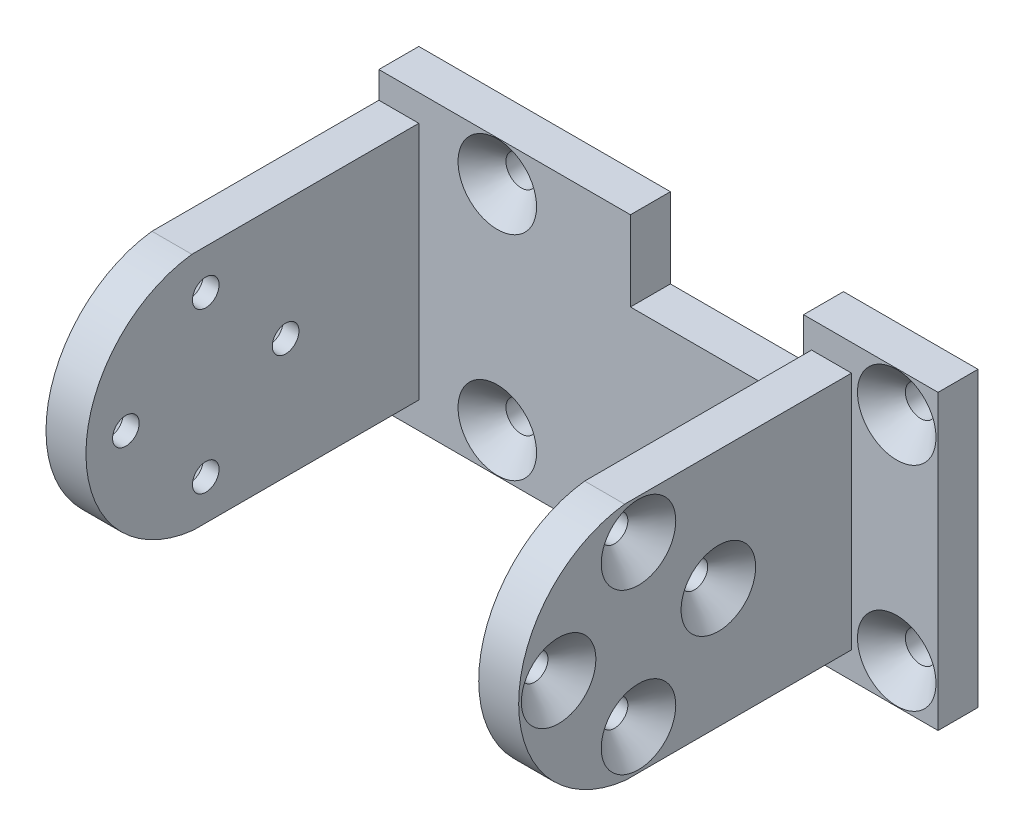
from build123d import *

# Parameters (mm, degrees)
SKETCH1_W                                       = 42
SKETCH1_H                                       = 22
BOSS_EXTRUDE1_DEPTH                             = 3
SKETCH2_W                                       = 13
SKETCH2_H                                       = 6
CUT_EXTRUDE1_DEPTH                              = 236.13156647
SKETCH3_W                                       = 13
SKETCH3_H                                       = 6
CUT_EXTRUDE2_DEPTH                              = 236.13156647
BOSS_EXTRUDE2_DEPTH                             = 3
BOSS_EXTRUDE3_START                             = -3
BOSS_EXTRUDE3_DEPTH                             = 3
F_2_0_2_DIAMETER_HOLE1_D                        = 2
F_2_0_2_DIAMETER_HOLE1_DEPTH                    = 3
F_2_0_2_DIAMETER_HOLE1_CSINK_D                  = 5.6
F_2_0_2_DIAMETER_HOLE1_CSINK_ANGLE              = 90
CSK_FOR_M2_FLAT_HEAD_MACHINE_SCREW1_D           = 2.3
CSK_FOR_M2_FLAT_HEAD_MACHINE_SCREW1_CSINK_D     = 5.9
CSK_FOR_M2_FLAT_HEAD_MACHINE_SCREW1_CSINK_ANGLE = 90
F_2_0_2_DIAMETER_HOLE2_D                        = 2
F_2_0_2_DIAMETER_HOLE2_DEPTH                    = 42
F_2_0_2_DIAMETER_HOLE2_CSINK_D                  = 5.6
F_2_0_2_DIAMETER_HOLE2_CSINK_ANGLE              = 90


with BuildPart() as part:
    # Sketch1 → Boss-Extrude1 (new body)
    with BuildSketch(Plane.XY.offset(47.892560215)):
        with Locations((8.75, 222.222621224)):
            Rectangle(SKETCH1_W, SKETCH1_H)
    extrude(amount=-BOSS_EXTRUDE1_DEPTH)

    # Sketch2 → Cut-Extrude1 (cut, through all)
    with BuildSketch(Plane(origin=(0, 0, 44.892560215), x_dir=(-1, 0, 0), z_dir=(0, 0, -1))):
        with Locations((-13.146676675, 230.222621224)):
            Rectangle(SKETCH2_W, SKETCH2_H)
    extrude(amount=-CUT_EXTRUDE1_DEPTH, mode=Mode.SUBTRACT)

    # Sketch3 → Cut-Extrude2 (cut, through all)
    with BuildSketch(Plane(origin=(0, 0, 44.892560215), x_dir=(-1, 0, 0), z_dir=(0, 0, -1))):
        with Locations((-13.146676675, 214.222621224)):
            Rectangle(SKETCH3_W, SKETCH3_H)
    extrude(amount=-CUT_EXTRUDE2_DEPTH, mode=Mode.SUBTRACT)

    # Sketch4 → Boss-Extrude2 (add)
    with BuildSketch(Plane(origin=(-12.25, 0, 0), x_dir=(0, -1, 0), z_dir=(-1, 0, 0))):
        with BuildLine():
            Line((-231.222621224, 64.935707597), (-231.222621224, 47.892560215))
            Line((-231.222621224, 47.892560215), (-213.222621224, 47.892560215))
            Line((-213.222621224, 47.892560215), (-213.222621224, 64.839486293))
            ThreePointArc((-213.222621224, 64.839486293), (-222.179830351, 72.892432503), (-231.222621224, 64.935707597))
        make_face()
    extrude(amount=-BOSS_EXTRUDE2_DEPTH)

    # Sketch5 → Boss-Extrude3 (add)
    with BuildSketch(Plane(origin=(23.25, 0, 0), x_dir=(0, 0, -1), z_dir=(1, 0, 0)).offset(BOSS_EXTRUDE3_START)):
        with BuildLine():
            Line((-64.839486293, 213.222621224), (-47.892560215, 213.222621224))
            Line((-47.892560215, 213.222621224), (-47.892560215, 231.222621224))
            Line((-47.892560215, 231.222621224), (-64.935707597, 231.222621224))
            ThreePointArc((-64.935707597, 231.222621224), (-72.892432503, 222.179830351), (-64.839486293, 213.222621224))
        make_face()
    extrude(amount=BOSS_EXTRUDE3_DEPTH)

    # Ø2.0 (2) Diameter Hole1
    with Locations(Plane(origin=(23.25, 0, 0), x_dir=(0, 0, -1), z_dir=(1, 0, 0))):
        with Locations((-63.892759177, 228.222223301), (-69.892560215, 222.222422263), (-63.892759177, 216.222621224), (-57.892958138, 222.222422263)):
            CounterSinkHole(F_2_0_2_DIAMETER_HOLE1_D / 2, F_2_0_2_DIAMETER_HOLE1_CSINK_D / 2, depth=F_2_0_2_DIAMETER_HOLE1_DEPTH, counter_sink_angle=F_2_0_2_DIAMETER_HOLE1_CSINK_ANGLE)

    # CSK for M2 Flat Head Machine Screw1 (through all)
    with Locations(Plane.XY.offset(47.892560215)):
        with Locations((-3.353323325, 230.214980721), (-3.353323325, 214.214980721), (26.646676675, 214.214980721), (26.646676675, 230.214980721)):
            CounterSinkHole(CSK_FOR_M2_FLAT_HEAD_MACHINE_SCREW1_D / 2, CSK_FOR_M2_FLAT_HEAD_MACHINE_SCREW1_CSINK_D / 2, counter_sink_angle=CSK_FOR_M2_FLAT_HEAD_MACHINE_SCREW1_CSINK_ANGLE)

    # Ø2.0 (2) Diameter Hole2
    with Locations(Plane.ZY.offset(12.25)):
        with Locations((63.892759177, 228.222223301), (69.892560215, 222.222422263), (63.892759177, 216.222621224), (57.892958138, 222.222422263)):
            CounterSinkHole(F_2_0_2_DIAMETER_HOLE2_D / 2, F_2_0_2_DIAMETER_HOLE2_CSINK_D / 2, depth=F_2_0_2_DIAMETER_HOLE2_DEPTH, counter_sink_angle=F_2_0_2_DIAMETER_HOLE2_CSINK_ANGLE)


solid = part.part
